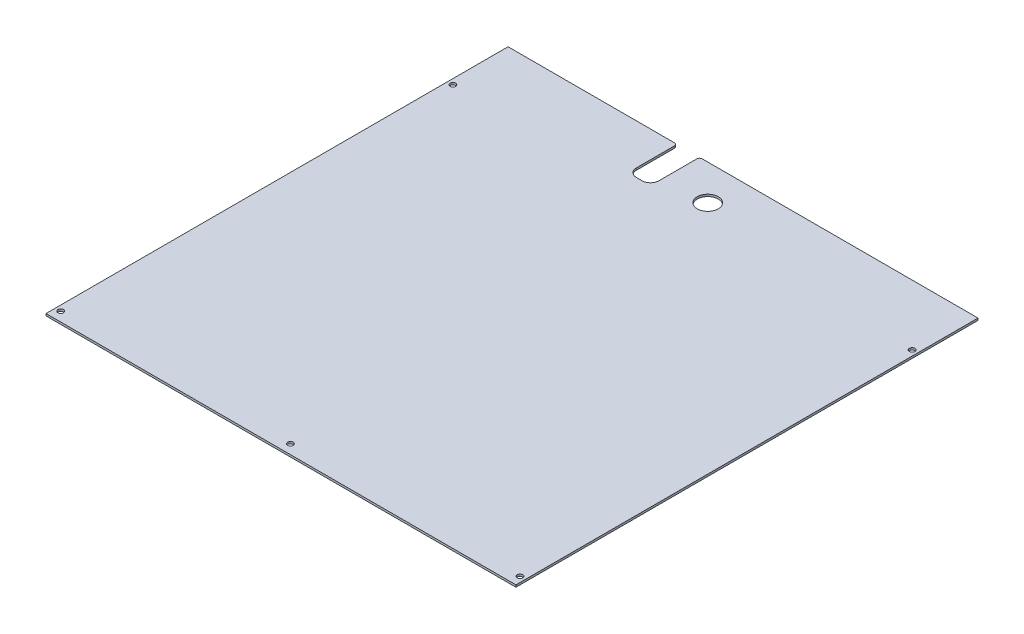
from build123d import *

# Parameters (mm, degrees)
CROQUIS12_W           = 335
CROQUIS12_H           = 329.4
BRIDA_BASE2_DEPTH     = 1.5
CORTAR_EXTRUIR6_REACH = 269.055
CROQUIS27_R           = 2
CORTAR_EXTRUIR7_REACH = 269.055
CROQUIS28_R           = 7.5
CROQUIS29_W           = 16
CROQUIS29_H           = 35
CORTAR_EXTRUIR8_DEPTH = 268.054938355
REDONDEO1_R           = 6
REDONDEO2_R           = 2


# Sheet-metal steps are written as plain solids
with BuildPart() as part:
    # Croquis12 → Brida base2 (new body)
    with BuildSketch(Plane(origin=(0, 0, 0), x_dir=(1, 0, 0), z_dir=(0, 1, 0))):
        with Locations((0, -43.29)):
            Rectangle(CROQUIS12_W, CROQUIS12_H)
    extrude(amount=-BRIDA_BASE2_DEPTH)

    # Croquis27 → Cortar-Extruir6 (cut, up to next)
    with BuildSketch(Plane(origin=(0, 0, 0), x_dir=(1, 0, 0), z_dir=(0, 1, 0)), mode=Mode.PRIVATE) as cortar_extruir6_sk1:
        with Locations(Location((-163.7, -201.3, 0), (0, 0, 270))):
            Circle(CROQUIS27_R)
    cortar_extruir6_tool1 = extrude(cortar_extruir6_sk1.sketch, amount=-CORTAR_EXTRUIR6_REACH, mode=Mode.PRIVATE) & part.part
    # Croquis27 → Cortar-Extruir6 (cut, up to next)
    with BuildSketch(Plane(origin=(0, 0, 0), x_dir=(1, 0, 0), z_dir=(0, 1, 0)), mode=Mode.PRIVATE) as cortar_extruir6_sk2:
        with Locations(Location((-163.7, 78.26, 0), (0, 0, 270))):
            Circle(CROQUIS27_R)
    cortar_extruir6_tool2 = extrude(cortar_extruir6_sk2.sketch, amount=-CORTAR_EXTRUIR6_REACH, mode=Mode.PRIVATE) & part.part
    # Croquis27 → Cortar-Extruir6 (cut, up to next)
    with BuildSketch(Plane(origin=(0, 0, 0), x_dir=(1, 0, 0), z_dir=(0, 1, 0)), mode=Mode.PRIVATE) as cortar_extruir6_sk3:
        with Locations(Location((163.7, 78.26, 0), (0, 0, 90))):
            Circle(CROQUIS27_R)
    cortar_extruir6_tool3 = extrude(cortar_extruir6_sk3.sketch, amount=-CORTAR_EXTRUIR6_REACH, mode=Mode.PRIVATE) & part.part
    # Croquis27 → Cortar-Extruir6 (cut, up to next)
    with BuildSketch(Plane(origin=(0, 0, 0), x_dir=(1, 0, 0), z_dir=(0, 1, 0)), mode=Mode.PRIVATE) as cortar_extruir6_sk4:
        with Locations(Location((163.7, -201.3, 0), (0, 0, 90))):
            Circle(CROQUIS27_R)
    cortar_extruir6_tool4 = extrude(cortar_extruir6_sk4.sketch, amount=-CORTAR_EXTRUIR6_REACH, mode=Mode.PRIVATE) & part.part
    # Croquis27 → Cortar-Extruir6 (cut, up to next)
    with BuildSketch(Plane(origin=(0, 0, 0), x_dir=(1, 0, 0), z_dir=(0, 1, 0)), mode=Mode.PRIVATE) as cortar_extruir6_sk5:
        with Locations(Location((0, -201.3, 0), (0, 0, 270))):
            Circle(CROQUIS27_R)
    cortar_extruir6_tool5 = extrude(cortar_extruir6_sk5.sketch, amount=-CORTAR_EXTRUIR6_REACH, mode=Mode.PRIVATE) & part.part
    add(cortar_extruir6_tool1.solids().sort_by_distance((-163.7, 0, 201.3))[0], mode=Mode.SUBTRACT)
    add(cortar_extruir6_tool2.solids().sort_by_distance((-163.7, 0, -78.26))[0], mode=Mode.SUBTRACT)
    add(cortar_extruir6_tool3.solids().sort_by_distance((163.7, 0, -78.26))[0], mode=Mode.SUBTRACT)
    add(cortar_extruir6_tool4.solids().sort_by_distance((163.7, 0, 201.3))[0], mode=Mode.SUBTRACT)
    add(cortar_extruir6_tool5.solids().sort_by_distance((0, 0, 201.3))[0], mode=Mode.SUBTRACT)

    # Croquis28 → Cortar-Extruir7 (cut, up to next)
    with BuildSketch(Plane(origin=(0, 0, 0), x_dir=(1, 0, 0), z_dir=(0, 1, 0)), mode=Mode.PRIVATE) as cortar_extruir7_sk1:
        with Locations(Location((0, 96.25, 0), (0, 0, 270))):
            Circle(CROQUIS28_R)
    cortar_extruir7_tool1 = extrude(cortar_extruir7_sk1.sketch, amount=-CORTAR_EXTRUIR7_REACH, mode=Mode.PRIVATE) & part.part
    add(cortar_extruir7_tool1.solids().sort_by_distance((0, 0, -96.25))[0], mode=Mode.SUBTRACT)

    # Croquis29 → Cortar-Extruir8 (cut, through all)
    with BuildSketch(Plane(origin=(0, 0, 0), x_dir=(1, 0, 0), z_dir=(0, 1, 0))):
        with Locations((-39, 103.91)):
            Rectangle(CROQUIS29_W, CROQUIS29_H)
    extrude(amount=-CORTAR_EXTRUIR8_DEPTH, mode=Mode.SUBTRACT)

    # Redondeo1
    redondeo1_edges = [part.edges().sort_by_distance(p)[0] for p in [
        (-47, -0.75, -86.41),
        (-31, -0.75, -86.41),
    ]]
    fillet(redondeo1_edges, radius=REDONDEO1_R)

    # Redondeo2
    redondeo2_edges = [part.edges().sort_by_distance(p)[0] for p in [
        (-47, -0.75, -121.41),
        (-31, -0.75, -121.41),
    ]]
    fillet(redondeo2_edges, radius=REDONDEO2_R)


solid = part.part
